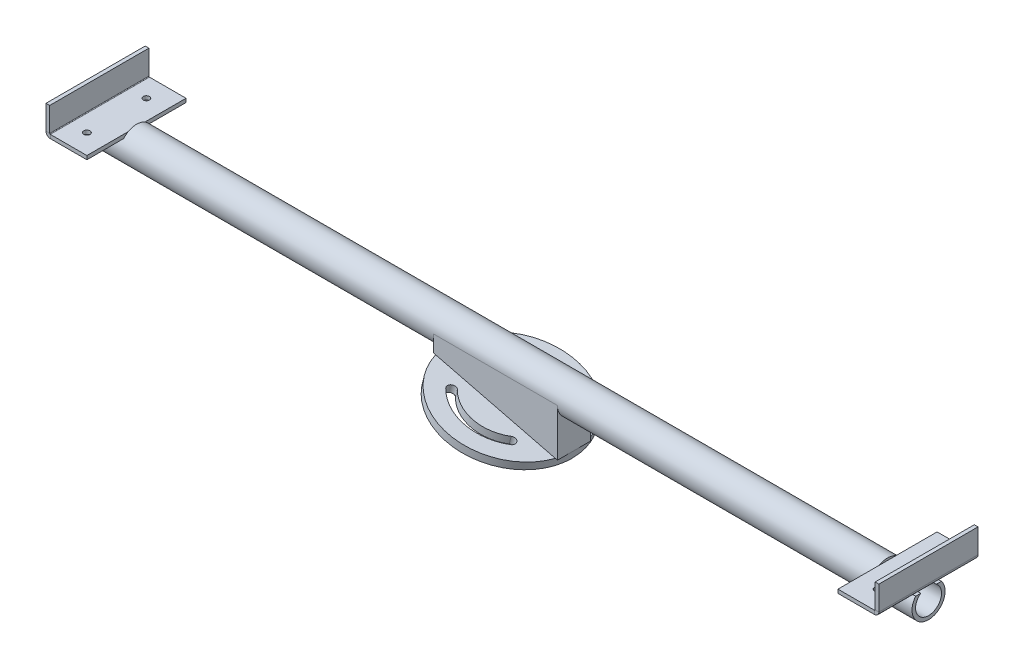
from build123d import *

# Parameters (mm, degrees)
SKETCH1_R                           = 13.335
SKETCH1_R_2                         = 10.465
BOSS_EXTRUDE1_DEPTH                 = 336.1
CUT_EXTRUDE3_START                  = -33.1
CUT_EXTRUDE3_DEPTH                  = 33.1
BASE_FLANGE2_DEPTH                  = 40
BASE_FLANGE2_DEPTH_BACK             = 40
SKETCH36_W                          = 2.5273
SKETCH36_H                          = 50
F_8_0_199_DIAMETER_HOLE4_AT_2_COUNT = 2
F_8_0_199_DIAMETER_HOLE4_AT_2_PITCH = 48
MIRROR5_START                       = -303
MIRROR5_OUTLINE_R                   = 13.335
MIRROR5_OUTLINE_R_2                 = 10.465
MIRROR5_DEPTH                       = 303
MIRROR5_START_2                     = -336.1
MIRROR5_2_DEPTH                     = 33.1
BOSS_EXTRUDE3_REACH                 = 341.935
SKETCH39_W                          = 100
SKETCH39_H                          = 26.67
SKETCH40_R                          = 51.530681467
BOSS_EXTRUDE4_DEPTH                 = 6.35
SKETCH43_W                          = 3.3782
SKETCH43_H                          = 143.233967446
F_1_4_CLEARANCE_HOLE1_AT_2_COUNT    = 2
F_1_4_CLEARANCE_HOLE1_AT_2_PITCH    = 49.497474683
F_1_4_CLEARANCE_HOLE1_AT_3_COUNT    = 2
F_1_4_CLEARANCE_HOLE1_AT_3_PITCH    = 70
F_1_4_CLEARANCE_HOLE1_AT_4_COUNT    = 2
F_1_4_CLEARANCE_HOLE1_AT_4_PITCH    = 49.497474683
F_1_4_CLEARANCE_HOLE1_AT_5_COUNT    = 2
F_1_4_CLEARANCE_HOLE1_AT_5_PITCH    = 26.787840266
F_1_4_CLEARANCE_HOLE1_AT_6_COUNT    = 2
F_1_4_CLEARANCE_HOLE1_AT_6_PITCH    = 64.671567276
CUT_EXTRUDE4_DEPTH                  = 354.000635368


# Read off the part's stored shape, not the designer's step: Mirror5
# Sheet-metal steps are written as plain solids
with BuildPart() as part:
    # Sketch1 → Boss-Extrude1 (new body)
    with BuildSketch(Plane(origin=(0, 0, 0), x_dir=(0, 0, -1), z_dir=(1, 0, 0))):
        Circle(SKETCH1_R)
        Circle(SKETCH1_R_2, mode=Mode.SUBTRACT)
    extrude(amount=BOSS_EXTRUDE1_DEPTH)

    # Sketch4 → Cut-Extrude3 (cut)
    with BuildSketch(Plane(origin=(336.1, 0, 0), x_dir=(0, 0, -1), z_dir=(1, 0, 0)).offset(CUT_EXTRUDE3_START)):
        with BuildLine():
            Line((-10.409130607, 8.335), (10.409130607, 8.335))
            ThreePointArc((10.409130607, 8.335), (0, 13.335), (-10.409130607, 8.335))
        make_face()
    extrude(amount=CUT_EXTRUDE3_DEPTH, mode=Mode.SUBTRACT)



with BuildPart() as body_2:
    # Sketch31 → Base-Flange2 (new, two sides: drawn at the far end of the back side and taken through both)
    with BuildSketch(Plane.XY.offset(-BASE_FLANGE2_DEPTH_BACK)):
        with BuildLine():
            Line((303, 11.51), (332.5, 11.51))
            ThreePointArc((332.5, 11.51), (332.853553391, 11.656446609), (333, 12.01))
            Line((333, 12.01), (333, 31.51))
            Line((333, 31.51), (336, 31.51))
            Line((336, 31.51), (336, 12.01))
            ThreePointArc((336, 12.01), (334.974873734, 9.535126266), (332.5, 8.51))
            Line((332.5, 8.51), (303, 8.51))
            Line((303, 8.51), (303, 11.51))
        make_face()
    extrude(amount=BASE_FLANGE2_DEPTH + BASE_FLANGE2_DEPTH_BACK)

    # Sketch36 → #8 (0.199) Diameter Hole4 (revolve, cut)
    with BuildSketch(Plane(origin=(319, 11.51, -24), x_dir=(0, 0, 1), z_dir=(1, 0, 0))):
        with Locations((1.26365, 25)):
            Rectangle(SKETCH36_W, SKETCH36_H)
    f_8_0_199_diameter_hole4 = revolve(axis=Axis((319, 17.86, -24), (0, -1, 0)), mode=Mode.SUBTRACT)

    # #8 (0.199) Diameter Hole4 at 2: #8 (0.199) Diameter Hole4 ×2
    with Locations(*[(0, 0, i * F_8_0_199_DIAMETER_HOLE4_AT_2_PITCH) for i in range(1, F_8_0_199_DIAMETER_HOLE4_AT_2_COUNT)]):
        add(f_8_0_199_diameter_hole4, mode=Mode.SUBTRACT)


with BuildPart() as body_3:
    # Mirror4: mirrored copy
    add(body_2.part.mirror(Plane(origin=(0, 0, 0), x_dir=(0, 0, 1), z_dir=(1, 0, 0))))


with BuildPart() as part_1:
    add(part.part)

    add(body_3.part)  # Mirror5 merges body 3
    # Mirror5 outline → Mirror5 (add)
    with BuildSketch(Plane.YZ.offset(MIRROR5_START)):
        Circle(MIRROR5_OUTLINE_R)
        Circle(MIRROR5_OUTLINE_R_2, mode=Mode.SUBTRACT)
    extrude(amount=MIRROR5_DEPTH)

    # Mirror5 2 outline → Mirror5 2 (add)
    with BuildSketch(Plane.YZ.offset(MIRROR5_START_2)):
        with BuildLine():
            Line((8.335, 6.32803287), (8.335, 10.409130607))
            ThreePointArc((8.335, 10.409130607), (-13.335, 0), (8.335, -10.409130607))
            Line((8.335, -10.409130607), (8.335, -6.32803287))
            ThreePointArc((8.335, -6.32803287), (-10.465, 0), (8.335, 6.32803287))
        make_face()
    extrude(amount=MIRROR5_2_DEPTH)

    # Boss-Extrude3: up to this plane
    boss_extrude3_end = Plane(origin=(-6.04804739, -24.257393157, 0), z_dir=(0.24192189559967145, 0.9702957262759956, 0))
    # Sketch39 → Boss-Extrude3 (add, up to the surface)
    with BuildSketch(Plane(origin=(0, 0, 0), x_dir=(1, 0, 0), z_dir=(0, 1, 0)), mode=Mode.PRIVATE) as boss_extrude3_sk1:
        Rectangle(SKETCH39_W, SKETCH39_H)
    boss_extrude3_tool1 = split(extrude(boss_extrude3_sk1.sketch, amount=-BOSS_EXTRUDE3_REACH, mode=Mode.PRIVATE), bisect_by=boss_extrude3_end, keep=Keep.BOTH, mode=Mode.PRIVATE)
    add(boss_extrude3_tool1.solids().sort_by_distance((0, 0, 0))[0])

    # Sketch40 → Boss-Extrude4 (add)
    with BuildSketch(Plane(origin=(-6.04804739, -24.257393157, 0), x_dir=(-0.9702957262759956, 0.24192189559967145, 0), z_dir=(-0.24192189559967145, -0.9702957262759956, 0))):
        with Locations(Location((-6.233200071, 0, 0), (0, 0, 180))):
            Circle(SKETCH40_R)
    extrude(amount=BOSS_EXTRUDE4_DEPTH)

    # Sketch43 → 1/4 Clearance Hole1 (revolve, cut)
    with BuildSketch(Plane(origin=(-25.54979811, -25.939457144, 24.748737342), x_dir=(0.9702957262759956, -0.24192189559967145, 0), z_dir=(0, 0, 1))):
        with Locations((1.6891, 71.616983723)):
            Rectangle(SKETCH43_W, SKETCH43_H)
    f_1_4_clearance_hole1 = revolve(axis=Axis((-27.086002147, -32.100835006, 24.748737342), (0.24192189559967142, 0.9702957262759956, 0)), mode=Mode.SUBTRACT)

    # 1/4 Clearance Hole1 at 2: 1/4 Clearance Hole1 ×2
    with Locations(*[Vector(0.9702957262759956, -0.24192189559967142, -4.076857218435412e-13) * (i * F_1_4_CLEARANCE_HOLE1_AT_2_PITCH) for i in range(1, F_1_4_CLEARANCE_HOLE1_AT_2_COUNT)]):
        add(f_1_4_clearance_hole1, mode=Mode.SUBTRACT)

    # 1/4 Clearance Hole1 at 3: 1/4 Clearance Hole1 ×2
    with Locations(*[Vector(0.6861026878060814, -0.17106461289603136, -0.7071067811865488) * (i * F_1_4_CLEARANCE_HOLE1_AT_3_PITCH) for i in range(1, F_1_4_CLEARANCE_HOLE1_AT_3_COUNT)]):
        add(f_1_4_clearance_hole1, mode=Mode.SUBTRACT)

    # 1/4 Clearance Hole1 at 4: 1/4 Clearance Hole1 ×2
    with Locations(*[(0, 0, -i * F_1_4_CLEARANCE_HOLE1_AT_4_PITCH) for i in range(1, F_1_4_CLEARANCE_HOLE1_AT_4_COUNT)]):
        add(f_1_4_clearance_hole1, mode=Mode.SUBTRACT)

    # 1/4 Clearance Hole1 at 5: 1/4 Clearance Hole1 ×2
    with Locations(*[Vector(0.8964363619897173, -0.22350668781090646, 0.3826834323647138) * (i * F_1_4_CLEARANCE_HOLE1_AT_5_PITCH) for i in range(1, F_1_4_CLEARANCE_HOLE1_AT_5_COUNT)]):
        add(f_1_4_clearance_hole1, mode=Mode.SUBTRACT)

    # 1/4 Clearance Hole1 at 6: 1/4 Clearance Hole1 ×2
    with Locations(*[Vector(0.37131609894011086, -0.09257950137226025, -0.9238795325114425) * (i * F_1_4_CLEARANCE_HOLE1_AT_6_PITCH) for i in range(1, F_1_4_CLEARANCE_HOLE1_AT_6_COUNT)]):
        add(f_1_4_clearance_hole1, mode=Mode.SUBTRACT)

    # Sketch45 → Cut-Extrude4 (cut, through all)
    with BuildSketch(Plane(origin=(-7.584251427, -30.418771019, 0), x_dir=(-0.9702957262759956, 0.24192189559967145, 0), z_dir=(-0.24192189559967145, -0.9702957262759956, 0))):
        with BuildLine():
            ThreePointArc((-33.370685541, -27.13748547), (-6.233200071, -38.3782), (20.904285399, -27.13748547))
            ThreePointArc((20.904285399, -27.13748547), (20.904285399, -22.359989213), (16.126789142, -22.359989213))
            ThreePointArc((16.126789142, -22.359989213), (-6.233200071, -31.6218), (-28.593189284, -22.359989213))
            ThreePointArc((-28.593189284, -22.359989213), (-33.370685541, -22.359989213), (-33.370685541, -27.13748547))
        make_face()
        with BuildLine():
            ThreePointArc((20.904285399, 27.13748547), (-6.233200071, 38.3782), (-33.370685541, 27.13748547))
            ThreePointArc((-33.370685541, 27.13748547), (-33.370685541, 22.359989213), (-28.593189284, 22.359989213))
            ThreePointArc((-28.593189284, 22.359989213), (-6.233200071, 31.6218), (16.126789142, 22.359989213))
            ThreePointArc((16.126789142, 22.359989213), (20.904285399, 22.359989213), (20.904285399, 27.13748547))
        make_face()
    extrude(amount=-CUT_EXTRUDE4_DEPTH, mode=Mode.SUBTRACT)


solid = Compound([body_2.part, part_1.part])
